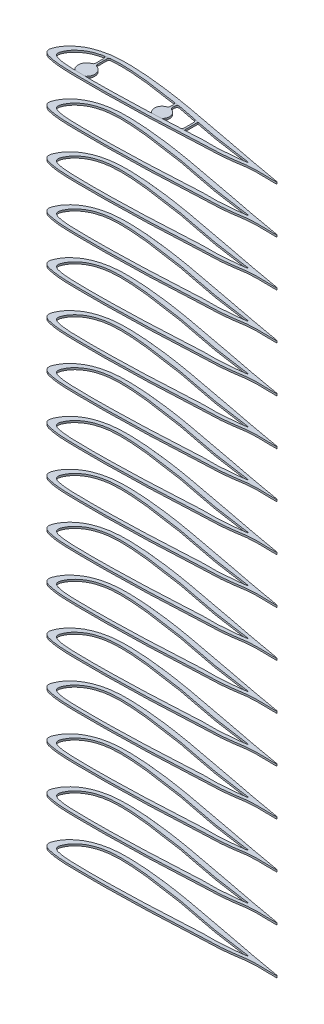
from build123d import *

# Parameters (mm, degrees)
BOSS_EXTRUDE2_DEPTH  = 0.8
SCALE3_SCALE         = 5
LPATTERN5_COUNT      = 16
LPATTERN5_PITCH      = 100
BOSS_EXTRUDE10_START = -4
BOSS_EXTRUDE10_DEPTH = 4


# Read off the part's stored shape, not the designer's step: Boss-Extrude10
with BuildPart() as part:
    # Sketch2 → Boss-Extrude2 (new body)
    with BuildSketch(Plane(origin=(0, 0, 0), x_dir=(1, 0, 0), z_dir=(0, 1, 0))):
        with BuildLine():
            add(Edge.make_bspline(
                [(100, 0), (100.062832481, 0.251035491), (88.423782974, 2.077171545), (80.42251087, 3.753346357), (69.886173545, 5.709443028), (60.038664734, 7.607750011), (50.016738031, 9.448794891), (40.032646993, 10.974024804), (31.681442376, 11.857617234), (25.003732925, 12.218802233), (19.991287342, 12.255901671), (14.932026744, 11.831525262), (10.552698907, 10.717194811), (7.226014658, 9.264268293), (4.894142811, 7.740900366), (3.227317175, 6.302068696), (1.907577305, 4.784574924), (1.090513349, 3.517602977), (0.31110434, 1.94974357), (-0.274693213, 0.387957211), (0.322414802, -0.985991259), (1.128085986, -1.553275899), (1.960743073, -1.980402203), (3.325075799, -2.314398918), (4.988474859, -2.651519441), (7.325893482, -2.960829773), (10.662702275, -3.183298157), (14.99974317, -3.252309923), (19.999702383, -3.317990736), (25.000304183, -3.335714915), (31.666611827, -3.233615687), (40.004541812, -3.118802793), (49.993702731, -2.747917107), (60.032071472, -2.329079334), (69.887259845, -1.735293531), (80.450181756, -1.52889579), (88.152686859, 0.472183304), (99.364358719, -0.207389158), (99.993827183, -0.02466234), (100, 0)],
                knots=[0, 0, 0, 0, 0.049040866, 0.098081731, 0.147122597, 0.196163463, 0.245116686, 0.293834629, 0.342263553, 0.366385573, 0.390475046, 0.414675268, 0.439565651, 0.455415353, 0.466907824, 0.479711554, 0.487090329, 0.495936907, 0.501323477, 0.512663454, 0.51831006, 0.521365152, 0.526751722, 0.531754914, 0.54158153, 0.551304728, 0.565797224, 0.589894838, 0.613986045, 0.638075566, 0.662166773, 0.710353523, 0.758560308, 0.806785868, 0.855025, 0.903284915, 0.951821054, 0.995182105, 1, 1, 1, 1], degree=3))
        make_face()
        with BuildLine():
            add(Edge.make_bspline(
                [(86.183913246, 1.13358502), (86.372858891, 1.474170217), (77.929405359, 2.346220059), (70.07678876, 3.611842733), (70.427684085, 3.467902229), (59.426188389, 5.481585854), (51.4929292, 7.297659916), (43.311969049, 8.240766344), (35.368460315, 9.602813594), (28.676997591, 10.275654448), (23.336198162, 10.569037312), (19.325967392, 10.597827694), (15.278633458, 10.258568206), (11.775152103, 9.367041979), (9.113807835, 8.204710915), (7.248309842, 6.986014902), (5.914849458, 5.834949969), (4.859057541, 4.620954885), (4.205406381, 3.607377343), (3.581879173, 2.353089814), (3.113241131, 1.103660729), (3.590927543, 0.004501952), (4.23546449, -0.449325759), (4.901590159, -0.791026803), (5.993056343, -1.058224173), (7.32377557, -1.327920613), (9.193710567, -1.575368772), (11.863156923, -1.753344215), (15.332794097, -1.80854879), (19.332743452, -1.861112987), (23.333291809, -1.875219729), (28.66600502, -1.793901534), (35.338887237, -1.699297338), (43.319708319, -1.413989187), (51.389408205, -1.03660017), (59.127981029, -0.719517885), (68.65199516, 0.080916694), (72.467902927, -0.572229318), (85.426438789, 0.827535825), (86.166964916, 1.103034697), (86.183913246, 1.13358502)],
                knots=[0, 0, 0, 0, 0.044139307, 0.053948042, 0.098087349, 0.147131023, 0.196174697, 0.245130724, 0.293851458, 0.342283155, 0.366406557, 0.390497409, 0.414699018, 0.439590826, 0.455441435, 0.466934565, 0.479739029, 0.487118226, 0.495965311, 0.501352189, 0.512692816, 0.518339744, 0.521395012, 0.52678189, 0.531785369, 0.541612547, 0.551336303, 0.565829629, 0.589928623, 0.61402121, 0.63811211, 0.662204697, 0.710394207, 0.758603753, 0.806832075, 0.855073969, 0.903336648, 0.960407262, 0.996040726, 1, 1, 1, 1], degree=3))
        make_face(mode=Mode.SUBTRACT)
    extrude(amount=BOSS_EXTRUDE2_DEPTH)


with BuildPart() as part_1:
    # Scale3: scaled about (0, 0, 0)
    add(part.part.scale(SCALE3_SCALE))


with BuildPart() as lpattern5_1:
    # LPattern5: pattern copy
    add(part_1.part.moved(Location(Vector(0, 1, 0) * (1 * LPATTERN5_PITCH))))


with BuildPart() as lpattern5_2:
    # LPattern5: pattern copy
    add(part_1.part.moved(Location(Vector(0, 1, 0) * (2 * LPATTERN5_PITCH))))


with BuildPart() as lpattern5_3:
    # LPattern5: pattern copy
    add(part_1.part.moved(Location(Vector(0, 1, 0) * (3 * LPATTERN5_PITCH))))


with BuildPart() as lpattern5_4:
    # LPattern5: pattern copy
    add(part_1.part.moved(Location(Vector(0, 1, 0) * (4 * LPATTERN5_PITCH))))


with BuildPart() as lpattern5_5:
    # LPattern5: pattern copy
    add(part_1.part.moved(Location(Vector(0, 1, 0) * (5 * LPATTERN5_PITCH))))


with BuildPart() as lpattern5_6:
    # LPattern5: pattern copy
    add(part_1.part.moved(Location(Vector(0, 1, 0) * (6 * LPATTERN5_PITCH))))


with BuildPart() as lpattern5_7:
    # LPattern5: pattern copy
    add(part_1.part.moved(Location(Vector(0, 1, 0) * (7 * LPATTERN5_PITCH))))


with BuildPart() as lpattern5_8:
    # LPattern5: pattern copy
    add(part_1.part.moved(Location(Vector(0, 1, 0) * (8 * LPATTERN5_PITCH))))


with BuildPart() as lpattern5_9:
    # LPattern5: pattern copy
    add(part_1.part.moved(Location(Vector(0, 1, 0) * (9 * LPATTERN5_PITCH))))


with BuildPart() as lpattern5_10:
    # LPattern5: pattern copy
    add(part_1.part.moved(Location(Vector(0, 1, 0) * (10 * LPATTERN5_PITCH))))


with BuildPart() as lpattern5_11:
    # LPattern5: pattern copy
    add(part_1.part.moved(Location(Vector(0, 1, 0) * (11 * LPATTERN5_PITCH))))


with BuildPart() as lpattern5_12:
    # LPattern5: pattern copy
    add(part_1.part.moved(Location(Vector(0, 1, 0) * (12 * LPATTERN5_PITCH))))


with BuildPart() as lpattern5_13:
    # LPattern5: pattern copy
    add(part_1.part.moved(Location(Vector(0, 1, 0) * (13 * LPATTERN5_PITCH))))


with BuildPart() as lpattern5_14:
    # LPattern5: pattern copy
    add(part_1.part.moved(Location(Vector(0, 1, 0) * (14 * LPATTERN5_PITCH))))


with BuildPart() as lpattern5_15:
    # LPattern5: pattern copy
    add(part_1.part.moved(Location(Vector(0, 1, 0) * (15 * LPATTERN5_PITCH))))


with BuildPart() as body_17:
    # Boss-Extrude10 outline → Boss-Extrude10 (new body)
    with BuildSketch(Plane(origin=(0, 1504, 0), x_dir=(1, 0, 0), z_dir=(0, 1, 0)).offset(BOSS_EXTRUDE10_START)):
        with BuildLine():
            ThreePointArc((73.422308632, 22.081885649), (61.237088458, 8.400097281), (67.3516121, -8.870789328))
            Line((67.3516121, -8.870789328), (90.034420442, -9.207668355))
            ThreePointArc((90.034420442, -9.207668355), (96.613548137, 8.137410888), (84.378830371, 22.081885649))
            ThreePointArc((84.378830371, 22.081885649), (81.862705236, 23.895851374), (80.900569501, 26.844690497))
            Line((80.900569501, 26.844690497), (80.900569501, 47.019570423))
            ThreePointArc((80.900569501, 47.019570423), (81.921192987, 50.046873275), (84.566394524, 51.838281572))
            Line((84.566394524, 51.838281572), (72.668486824, 50.030685746))
            ThreePointArc((72.668486824, 50.030685746), (75.697909795, 48.342730319), (76.900569501, 45.090007353))
            Line((76.900569501, 45.090007353), (76.900569501, 26.844690497))
            ThreePointArc((76.900569501, 26.844690497), (75.938433767, 23.895851374), (73.422308632, 22.081885649))
        make_face()
        with BuildLine():
            ThreePointArc((236.88108463, 22.033603855), (226.075874243, 9.274568833), (232.076756223, -6.331037905))
            Line((232.076756223, -6.331037905), (253.521212632, -5.351671674))
            ThreePointArc((253.521212632, -5.351671674), (258.281322075, 10.015891933), (247.613896362, 22.058594361))
            ThreePointArc((247.613896362, 22.058594361), (245.176477157, 23.883328692), (244.249410381, 26.783538159))
            Line((244.249410381, 26.783538159), (244.249410381, 31.992356109))
            ThreePointArc((244.249410381, 31.992356109), (245.954831692, 35.753439897), (249.907710885, 36.948830708))
            Line((249.907710885, 36.948830708), (235.98194491, 38.937532666))
            ThreePointArc((235.98194491, 38.937532666), (239.032513408, 37.25687688), (240.245570611, 33.992054641))
            Line((240.245570611, 33.992054641), (240.245570611, 26.758547653))
            ThreePointArc((240.245570611, 26.758547653), (239.318503835, 23.858338186), (236.88108463, 22.033603855))
        make_face()
        with BuildLine():
            add(Edge.make_bspline(
                [(291.215022088, 28.990233113), (294.055847953, 28.398961541), (296.97816774, 27.796365804), (300.001681664, 27.185952739), (300.002522508, 27.185782983)],
                knots=[0.843660873, 0.843660873, 0.843660873, 0.843660873, 0.852868977, 0.852871538, 0.852871538, 0.852871538, 0.852871538], degree=3))
            ThreePointArc((291.215022088, 28.990233113), (294.723904159, 25.348789224), (296.002522508, 20.456192562))
            Line((296.002522508, 20.456192562), (296.002522508, 1.426252309))
            ThreePointArc((296.002522508, 1.426252309), (294.699822153, -1.939750563), (291.470532374, -3.55179618))
            Line((291.470532374, -3.55179618), (300.002522508, -3.014515043))
            Line((300.002522508, -3.014515043), (300.002522508, 27.185782983))
        make_face()
    extrude(amount=BOSS_EXTRUDE10_DEPTH)


solid = Compound([part_1.part, lpattern5_1.part, lpattern5_2.part, lpattern5_3.part, lpattern5_4.part, lpattern5_5.part, lpattern5_6.part, lpattern5_7.part, lpattern5_8.part, lpattern5_9.part, lpattern5_10.part, lpattern5_11.part, lpattern5_12.part, lpattern5_13.part, lpattern5_14.part, lpattern5_15.part, body_17.part])
